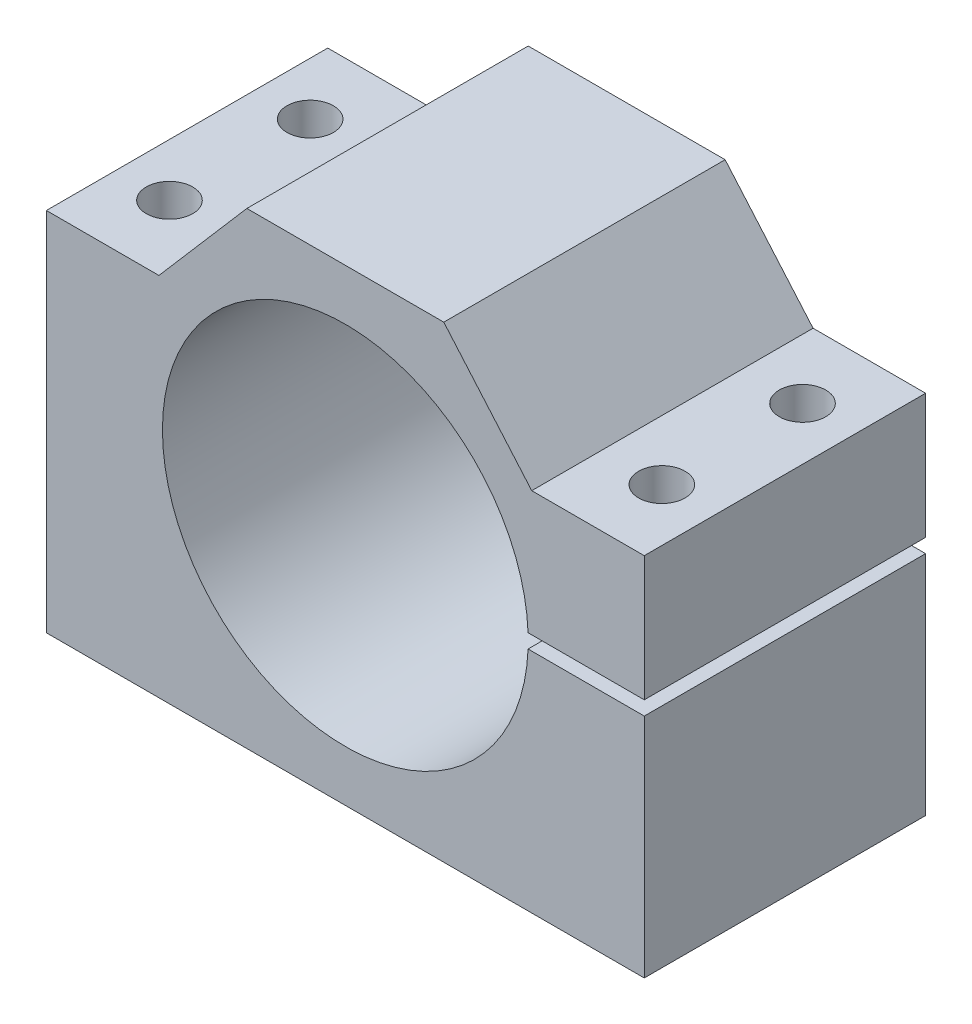
from build123d import *

# Parameters (mm, degrees)
ESQUISSE1_R             = 26
BOSS_EXTRU_1_DEPTH      = 40
ENL_V_MAT_EXTRU_1_REACH = 184.502
ESQUISSE3_R             = 3.3
ENL_V_MAT_EXTRU_2_DEPTH = 179.283669838


with BuildPart() as part:
    # Esquisse1 → Boss.-Extru.1 (new body)
    with BuildSketch(Plane.XY):
        Polygon((-165.774144338, -1.493499921), (-80.774144338, -1.493499921), (-80.774144338, 50.506500079), (-96.774144338, 50.506500079), (-109.274144338, 65.006500079), (-137.274144338, 65.006500079), (-149.774144338, 50.506500079), (-165.774144338, 50.506500079), align=None)
        with Locations((-123.274144338, 31.756500079)):
            Circle(ESQUISSE1_R, mode=Mode.SUBTRACT)
    extrude(amount=BOSS_EXTRU_1_DEPTH)

    # Esquisse2 → Enlèv. mat.-Extru.1 (cut, up to next)
    with BuildSketch(Plane.XY.offset(40), mode=Mode.PRIVATE) as enl_v_mat_extru_1_sk1:
        with BuildLine():
            Line((-97.293382224, 32.756500079), (-80.774144338, 32.756500079))
            Line((-80.774144338, 32.756500079), (-80.774144338, 30.756500079))
            Line((-80.774144338, 30.756500079), (-97.293382224, 30.756500079))
            ThreePointArc((-97.293382224, 30.756500079), (-97.274144338, 31.756500079), (-97.293382224, 32.756500079))
        make_face()
    enl_v_mat_extru_1_tool1 = extrude(enl_v_mat_extru_1_sk1.sketch, amount=-ENL_V_MAT_EXTRU_1_REACH, mode=Mode.PRIVATE) & part.part
    add(enl_v_mat_extru_1_tool1.solids().sort_by_distance((-89.027351, 31.7565, 40))[0], mode=Mode.SUBTRACT)

    # Esquisse3 → Enlèv. mat.-Extru.2 (cut, through all)
    with BuildSketch(Plane(origin=(0, 50.506500079, 0), x_dir=(1, 0, 0), z_dir=(0, 1, 0))):
        with Locations((-158.274144338, -10)):
            Circle(ESQUISSE3_R)
        with Locations((-158.274144338, -30)):
            Circle(ESQUISSE3_R)
        with Locations((-88.274144338, -10)):
            Circle(ESQUISSE3_R)
        with Locations((-88.274144338, -30)):
            Circle(ESQUISSE3_R)
    extrude(amount=-ENL_V_MAT_EXTRU_2_DEPTH, mode=Mode.SUBTRACT)


solid = part.part
